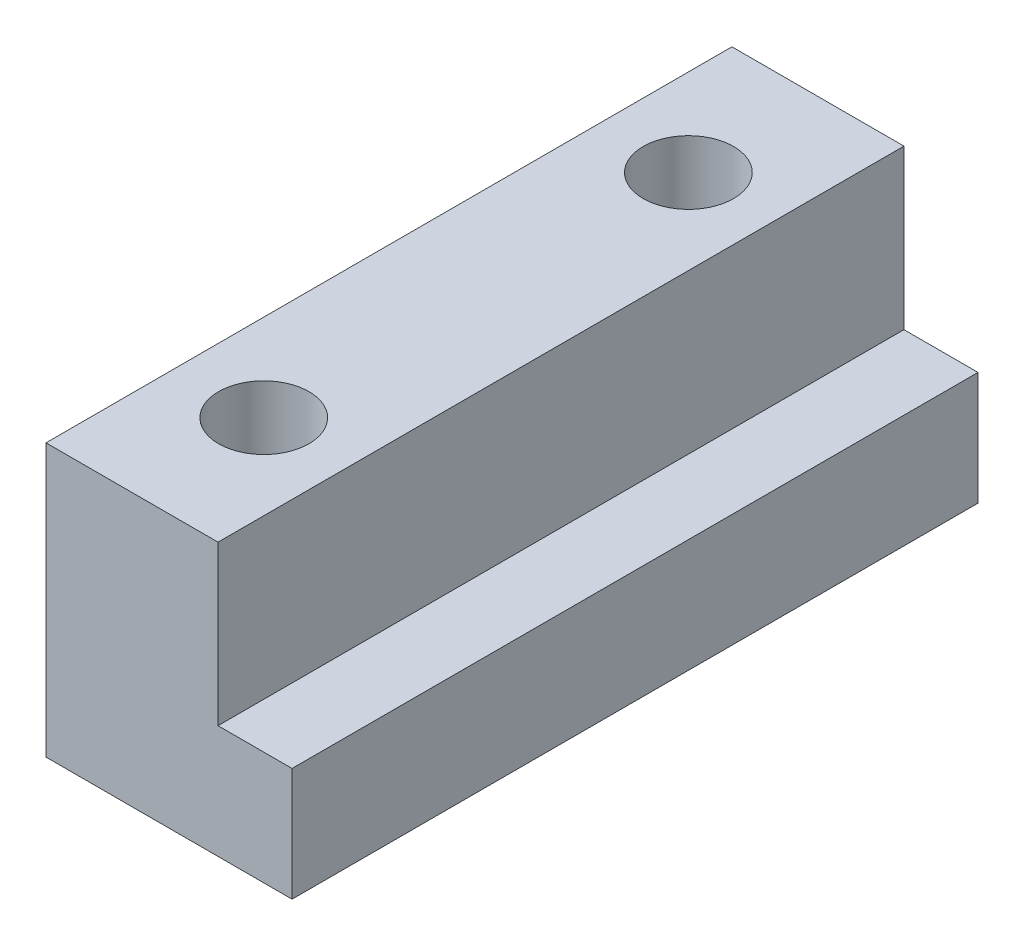
from build123d import *

# Parameters (mm, degrees)
BOSS_EXTRUDE1_DEPTH = 31.5
SKETCH2_R           = 2.075
CUT_EXTRUDE1_DEPTH  = 7


with BuildPart() as part:
    # Sketch1 → Boss-Extrude1 (new body)
    with BuildSketch(Plane.XY):
        Polygon((0, 0), (0, 12.5), (7.9, 12.5), (7.9, 5.2), (11.3, 5.2), (11.3, 0), align=None)
    extrude(amount=-BOSS_EXTRUDE1_DEPTH)

    # Sketch2 → Cut-Extrude1 (cut)
    with BuildSketch(Plane(origin=(0, 12.5, 0), x_dir=(1, 0, 0), z_dir=(0, 1, 0))):
        with Locations((4, 6)):
            Circle(SKETCH2_R)
        with Locations((4, 25.5)):
            Circle(SKETCH2_R)
    extrude(amount=-CUT_EXTRUDE1_DEPTH, mode=Mode.SUBTRACT)


solid = part.part
